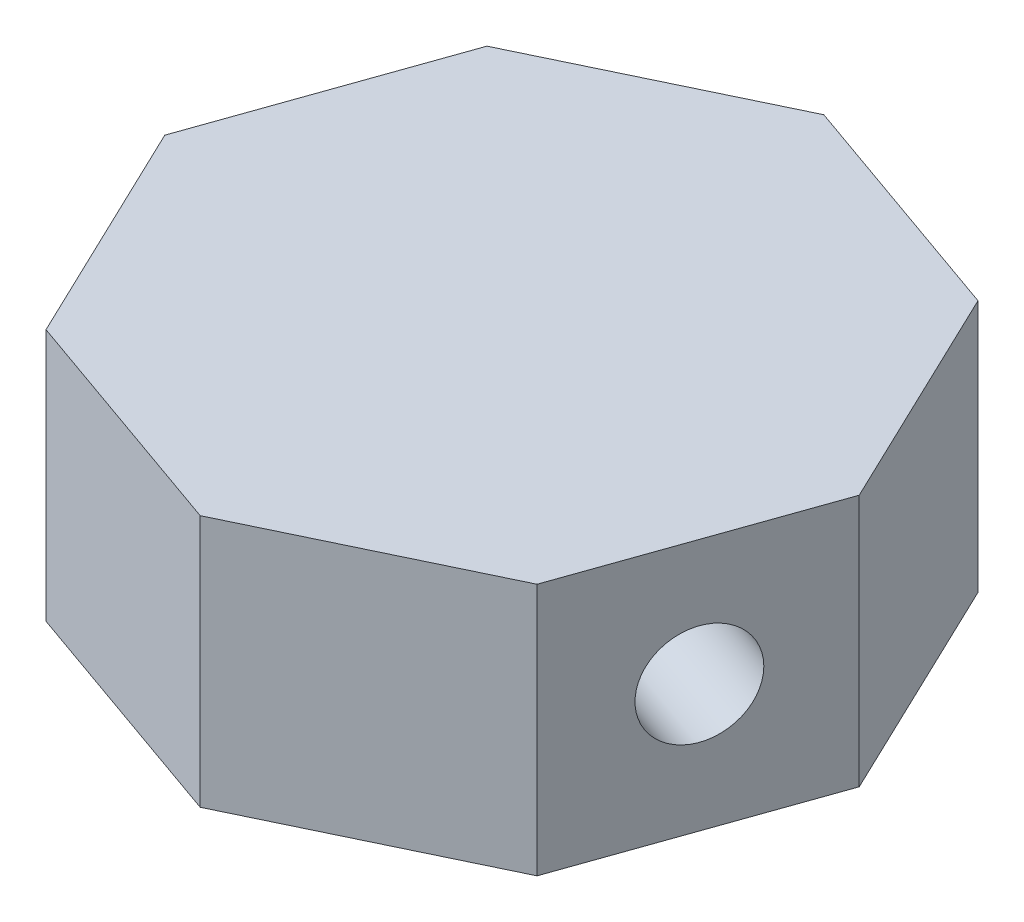
from build123d import *

# Parameters (mm, degrees)
BOSS_EXTRUDE1_DEPTH = 12.7
SKETCH2_R           = 2.54
CUT_EXTRUDE1_DEPTH  = 12.7
SKETCH3_R           = 3.175
CUT_EXTRUDE2_DEPTH  = 2.54


with BuildPart() as part:
    # Sketch1 → Boss-Extrude1 (new body)
    with BuildSketch(Plane(origin=(0, 0, 0), x_dir=(1, 0, 0), z_dir=(0, 1, 0))):
        Polygon((0.613239188, 0.098062109), (4.836414625, 12.07532345), (-0.6465521, 23.530762153), (-12.623813441, 27.75393759), (-24.079252145, 22.270970865), (-28.302427581, 10.293709523), (-22.819460856, -1.16172918), (-10.842199515, -5.384904617), align=None)
    extrude(amount=BOSS_EXTRUDE1_DEPTH)

    # Sketch2 → Cut-Extrude1 (cut)
    with BuildSketch(Plane(origin=(0.514674893, 0, 0.18147407), x_dir=(0.33253349893190465, 0, -0.9430914441813716), z_dir=(0.9430914441813716, 0, 0.33253349893190465))):
        with Locations((6.696420315, 6.400016207)):
            Circle(SKETCH2_R)
    extrude(amount=-CUT_EXTRUDE1_DEPTH, mode=Mode.SUBTRACT)

    # Sketch3 → Cut-Extrude2 (cut)
    with BuildSketch(Plane.XZ):
        with Locations((-11.782275887, -11.160934454)):
            Circle(SKETCH3_R)
    extrude(amount=-CUT_EXTRUDE2_DEPTH, mode=Mode.SUBTRACT)


solid = part.part
